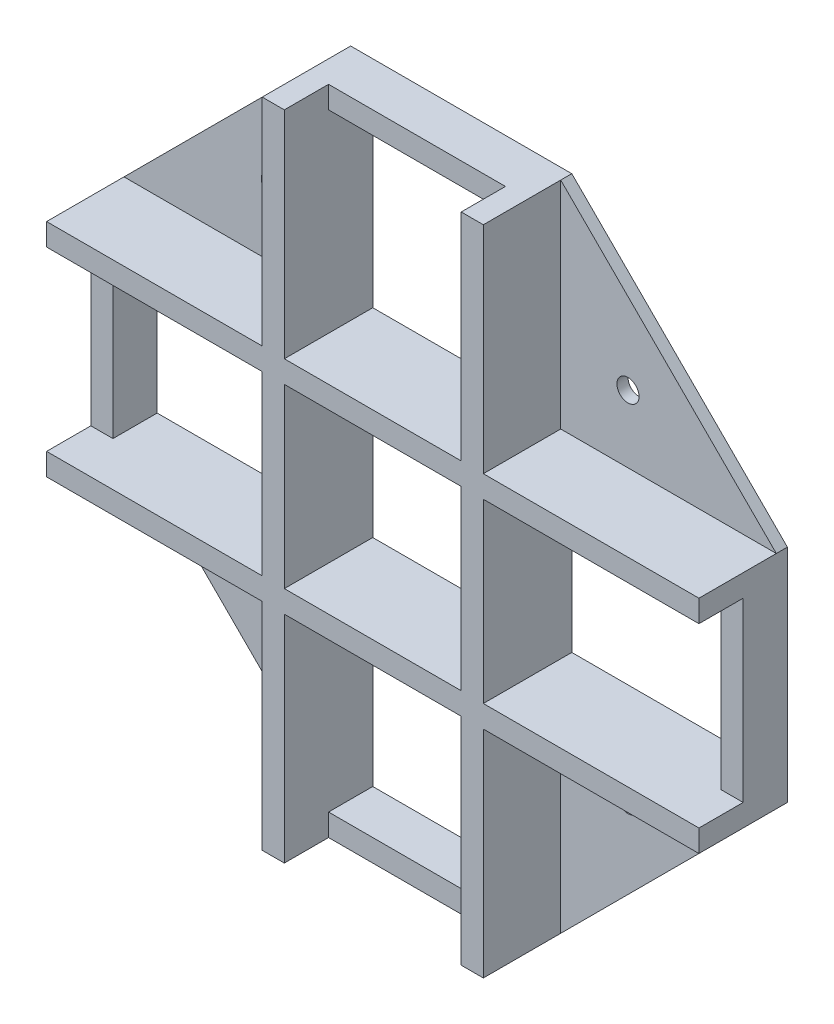
from build123d import *

# Parameters (mm, degrees)
BOSS_EXTRUDE1_DEPTH = 10.16
SKETCH2_W           = 20.32
SKETCH2_H           = 20.32
SKETCH2_H_2         = 22.225
SKETCH2_W_2         = 22.225
CUT_EXTRUDE1_DEPTH  = 10.16
SKETCH4_W           = 20.32
SKETCH4_H           = 2.54
SKETCH4_W_2         = 2.54
SKETCH4_H_2         = 20.32
CUT_EXTRUDE2_DEPTH  = 5.08
BOSS_EXTRUDE2_DEPTH = 1.27
SKETCH6_R           = 1.27
CUT_EXTRUDE3_DEPTH  = 1.27


with BuildPart() as part:
    # Sketch1 → Boss-Extrude1 (new body)
    with BuildSketch(Plane.XY):
        Polygon((-12.7, -37.465), (12.7, -37.465), (12.7, -12.7), (37.465, -12.7), (37.465, 12.7), (12.7, 12.7), (12.7, 37.465), (-12.7, 37.465), (-12.7, 12.7), (-37.465, 12.7), (-37.465, -12.7), (-12.7, -12.7), align=None)
    extrude(amount=BOSS_EXTRUDE1_DEPTH)

    # Sketch2 → Cut-Extrude1 (cut)
    with BuildSketch(Plane.XY.offset(10.16)):
        Rectangle(SKETCH2_W, SKETCH2_H)
        with Locations((0, 23.8125)):
            Rectangle(SKETCH2_W, SKETCH2_H_2)
        with Locations((0, -23.8125)):
            Rectangle(SKETCH2_W, SKETCH2_H_2)
        with Locations((-23.8125, 0)):
            Rectangle(SKETCH2_W_2, SKETCH2_H)
        with Locations((23.8125, 0)):
            Rectangle(SKETCH2_W_2, SKETCH2_H)
    extrude(amount=-CUT_EXTRUDE1_DEPTH, mode=Mode.SUBTRACT)

    # Sketch4 → Cut-Extrude2 (cut)
    with BuildSketch(Plane.XY.offset(10.16)):
        with Locations((0, 36.195)):
            Rectangle(SKETCH4_W, SKETCH4_H)
        with Locations((36.195, 0)):
            Rectangle(SKETCH4_W_2, SKETCH4_H_2)
        with Locations((-36.195, 0)):
            Rectangle(SKETCH4_W_2, SKETCH4_H_2)
        with Locations((0, -36.195)):
            Rectangle(SKETCH4_W, SKETCH4_H)
    extrude(amount=-CUT_EXTRUDE2_DEPTH, mode=Mode.SUBTRACT)

    # Sketch5 → Boss-Extrude2 (add)
    with BuildSketch(Plane.XY):
        Polygon((-37.465, 12.7), (-12.7, 37.465), (-12.7, 12.7), align=None)
        Polygon((12.7, 37.465), (37.465, 12.7), (12.7, 12.7), align=None)
        Polygon((37.465, -12.7), (12.7, -12.7), (12.7, -37.465), align=None)
        Polygon((-12.7, -37.465), (-12.7, -12.7), (-37.465, -12.7), align=None)
    extrude(amount=BOSS_EXTRUDE2_DEPTH)

    # Sketch6 → Cut-Extrude3 (cut)
    with BuildSketch(Plane.XY.offset(1.27)):
        with Locations((-20.425141584, 20.425141584)):
            Circle(SKETCH6_R)
        with Locations((20.425141584, 20.425141584)):
            Circle(SKETCH6_R)
        with Locations((20.425141584, -20.425141584)):
            Circle(SKETCH6_R)
        with Locations((-20.425141584, -20.425141584)):
            Circle(SKETCH6_R)
    extrude(amount=-CUT_EXTRUDE3_DEPTH, mode=Mode.SUBTRACT)


solid = part.part
